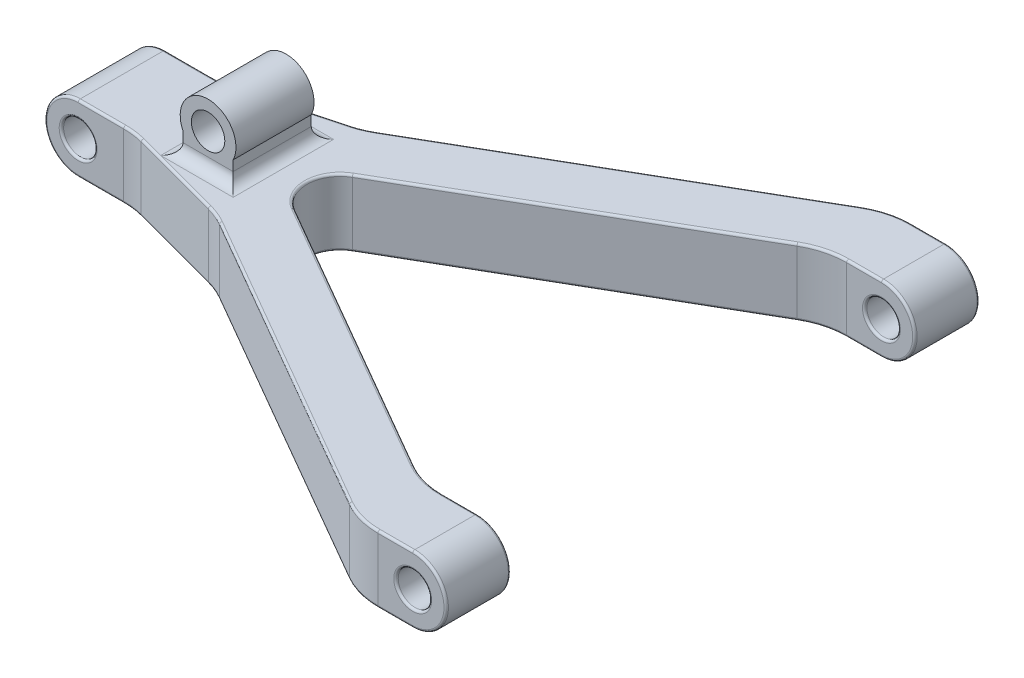
from build123d import *

# Parameters (mm, degrees)
BOSS_EXTRUDE1_DEPTH     = 60
SKETCH2_R               = 30
BOSS_EXTRUDE2_DEPTH     = 78
SKETCH3_R               = 15
CUT_EXTRUDE1_DEPTH      = 78
SKETCH4_R               = 30
BOSS_EXTRUDE3_DEPTH     = 57.74
BOSS_EXTRUDE4_START     = -57.74
SKETCH5_R               = 30
BOSS_EXTRUDE4_DEPTH     = 57.74
CUT_EXTRUDE2_DEPTH      = 588.619530081
CUT_EXTRUDE2_DEPTH_BACK = 588.619530081
SKETCH7_R               = 15
FILLET1_R               = 70
FILLET2_R               = 2
SKETCH8_W               = 45
SKETCH8_H               = 70
BOSS_EXTRUDE5_DEPTH     = 30
SKETCH11_R              = 25
BOSS_EXTRUDE6_DEPTH     = 70
SKETCH12_R              = 15
CUT_EXTRUDE3_DEPTH      = 449.902787027
FILLET3_R               = 10


with BuildPart() as part:
    # Sketch1 → Boss-Extrude1 (new body)
    with BuildSketch(Plane(origin=(0, 0, 0), x_dir=(1, 0, 0), z_dir=(0, 1, 0))):
        with BuildLine():
            Line((-193.529032258, -39), (-193.529032258, 39))
            Line((-193.529032258, 39), (-143.529032258, 39))
            Line((-143.529032258, 39), (-43.529032258, 65.794919243))
            Line((-43.529032258, 65.794919243), (256.470967742, 239))
            Line((256.470967742, 239), (306.470967742, 239))
            Line((306.470967742, 239), (306.470967742, 181.26))
            Line((306.470967742, 181.26), (256.462354113, 181.26))
            Line((256.462354113, 181.26), (-12.489175267, 25.980762114))
            ThreePointArc((-12.489175267, 25.980762114), (-27.489175267, 0), (-12.489175267, -25.980762114))
            Line((-12.489175267, -25.980762114), (256.462354113, -181.26))
            Line((256.462354113, -181.26), (306.470967742, -181.26))
            Line((306.470967742, -181.26), (306.470967742, -239))
            Line((306.470967742, -239), (256.470967742, -239))
            Line((256.470967742, -239), (-43.529032258, -65.794919243))
            Line((-43.529032258, -65.794919243), (-143.529032258, -39))
            Line((-143.529032258, -39), (-193.529032258, -39))
        make_face()
    extrude(amount=BOSS_EXTRUDE1_DEPTH)

    # Sketch2 → Boss-Extrude2 (add)
    with BuildSketch(Plane.XY.offset(39)):
        with Locations((-193.529032258, 30)):
            Circle(SKETCH2_R)
    extrude(amount=-BOSS_EXTRUDE2_DEPTH)

    # Sketch3 → Cut-Extrude1 (cut)
    with BuildSketch(Plane.XY.offset(39)):
        with Locations((-193.529032258, 30)):
            Circle(SKETCH3_R)
    extrude(amount=-CUT_EXTRUDE1_DEPTH, mode=Mode.SUBTRACT)

    # Sketch4 → Boss-Extrude3 (add)
    with BuildSketch(Plane(origin=(0, 0, -239), x_dir=(-1, 0, 0), z_dir=(0, 0, -1))):
        with Locations((-306.470967742, 30)):
            Circle(SKETCH4_R)
    extrude(amount=-BOSS_EXTRUDE3_DEPTH)

    # Sketch5 → Boss-Extrude4 (add)
    with BuildSketch(Plane.XY.offset(239).offset(BOSS_EXTRUDE4_START)):
        with Locations((306.470967742, 30)):
            Circle(SKETCH5_R)
    extrude(amount=BOSS_EXTRUDE4_DEPTH)

    # Sketch7 → Cut-Extrude2 (cut, two sides: drawn at the far end of the back side and taken through both)
    with BuildSketch(Plane(origin=(0, 0, -239), x_dir=(-1, 0, 0), z_dir=(0, 0, -1)).offset(-CUT_EXTRUDE2_DEPTH_BACK)):
        with Locations((-306.470967742, 30)):
            Circle(SKETCH7_R)
    extrude(amount=CUT_EXTRUDE2_DEPTH + CUT_EXTRUDE2_DEPTH_BACK, mode=Mode.SUBTRACT)

    # Fillet1
    fillet1_edges = [part.edges().sort_by_distance(p)[0] for p in [
        (256.462354113, 30, -181.26),
        (256.462354113, 30, 181.26),
        (256.470967742, 30, 239),
        (-43.529032258, 30, 65.794919243),
        (-143.529032258, 30, 39),
        (-143.529032258, 30, -39),
        (-43.529032258, 30, -65.794919243),
        (256.470967742, 30, -239),
    ]]
    fillet(fillet1_edges, radius=FILLET1_R)

    # Fillet2
    fillet2_edges = [part.edges().sort_by_distance(p)[0] for p in [
        (290.844882663, 60, -181.26),
        (102.339693735, 60, -150.012267462),
        (113.864811158, 60, 98.931270189),
        (257.110078055, 60, -236.61480784),
        (257.110078055, 60, 236.61480784),
        (-143.607873634, 0, -39.598859704),
        (-143.607873634, 60, -39.598859704),
        (-143.607873634, 0, 39.598859704),
        (-143.607873634, 60, 39.598859704),
        (-43.760183476, 0, 66.352967648),
        (-43.760183476, 60, 66.352967648),
        (257.101464426, 0, 178.87480784),
        (257.101464426, 60, 178.87480784),
        (257.101464426, 0, -178.87480784),
        (257.101464426, 60, -178.87480784),
        (-43.760183476, 0, -66.352967648),
        (-43.760183476, 60, -66.352967648),
        (290.849189477, 60, -239),
        (113.864811158, 0, -98.931270189),
        (-27.489175267, 0, 0),
        (290.844882663, 0, 181.26),
        (-173.136869674, 0, 39),
        (290.849189477, 0, -239),
        (-173.136869674, 60, 39),
        (-223.529032258, 30, 39),
        (-223.529032258, 30, -39),
        (290.844882663, 60, 181.26),
        (-208.529032258, 30, 39),
        (-208.529032258, 30, -39),
        (336.470967742, 30, -239),
        (-27.489175267, 60, 0),
        (336.470967742, 30, -181.26),
        (113.864811158, 60, -98.931270189),
        (336.470967742, 30, 239),
        (336.470967742, 30, 181.26),
        (321.470967742, 30, -239),
        (321.470967742, 30, -181.26),
        (321.470967742, 30, 239),
        (321.470967742, 30, 181.26),
        (-173.136869674, 0, -39),
        (-173.136869674, 60, -39),
        (-93.529032258, 0, -52.397459622),
        (-93.529032258, 60, -52.397459622),
        (-93.529032258, 0, 52.397459622),
        (-93.529032258, 60, 52.397459622),
        (290.849189477, 0, 239),
        (290.849189477, 60, 239),
        (290.844882663, 0, -181.26),
        (113.864811158, 0, 98.931270189),
        (102.339693735, 0, 150.012267462),
        (102.339693735, 0, -150.012267462),
        (257.110078055, 0, -236.61480784),
        (257.110078055, 0, 236.61480784),
        (102.339693735, 60, 150.012267462),
    ]]
    fillet(fillet2_edges, radius=FILLET2_R)

    # Sketch8 → Boss-Extrude5 (add)
    with BuildSketch(Plane(origin=(0, 60, 0), x_dir=(1, 0, 0), z_dir=(0, 1, 0))):
        with Locations((-81.029032258, 0)):
            Rectangle(SKETCH8_W, SKETCH8_H)
    extrude(amount=BOSS_EXTRUDE5_DEPTH)

    # Sketch11 → Boss-Extrude6 (add)
    with BuildSketch(Plane.XY.offset(35)):
        with Locations((-81.029032258, 90)):
            Circle(SKETCH11_R)
    extrude(amount=-BOSS_EXTRUDE6_DEPTH)

    # Sketch12 → Cut-Extrude3 (cut, through all)
    with BuildSketch(Plane.XY.offset(35)):
        with Locations((-81.029032258, 90)):
            Circle(SKETCH12_R)
    extrude(amount=-CUT_EXTRUDE3_DEPTH, mode=Mode.SUBTRACT)

    # Fillet3
    # the kernel refuses this fillet: 10 mm, written as the material it adds along each edge
    with BuildSketch(Plane(origin=(-58.529032258, 60, -35), x_dir=(1, 0, 0), z_dir=(0, 0, 1)), Plane(origin=(-103.529032258, 60, 35), x_dir=(-1, 0, 0), z_dir=(0, 0, -1))) as fillet3_piece_1:
        with BuildLine():
            CenterArc((FILLET3_R, FILLET3_R), FILLET3_R, 180, 90)
            Line((0, FILLET3_R), (0, 0))
            Line((0, 0), (FILLET3_R, 0))
        make_face()
    extrude(amount=70)
    with BuildSketch(Plane(origin=(-103.529032258, 60, -35), x_dir=(0, 0, -1), z_dir=(1, 0, 0)), Plane(origin=(-58.529032258, 60, 35), x_dir=(0, 0, 1), z_dir=(-1, 0, 0))) as fillet3_piece_2:
        with BuildLine():
            CenterArc((FILLET3_R, FILLET3_R), FILLET3_R, 180, 90)
            Line((0, FILLET3_R), (0, 0))
            Line((0, 0), (FILLET3_R, 0))
        make_face()
    extrude(amount=45)
    with BuildSketch(Plane(origin=(-103.529032258, 60, -35), x_dir=(0, 0, -1), z_dir=(1, 0, 0))) as fillet3_piece_3a_section:
        with BuildLine():
            CenterArc((FILLET3_R, FILLET3_R), FILLET3_R, 180, 90)
            Line((0, FILLET3_R), (0, 0))
            Line((0, 0), (FILLET3_R, 0))
        make_face()
    fillet3_piece_3a = extrude(amount=70, mode=Mode.PRIVATE)
    fillet3_piece_3a = split(fillet3_piece_3a, bisect_by=Plane(origin=(-58.529032258, 62.263951143, -37.263951143), z_dir=(1, 0, 0)), keep=Keep.TOP, mode=Mode.PRIVATE)
    with BuildSketch(Plane(origin=(-58.529032258, 60, -60), x_dir=(1, 0, 0), z_dir=(0, 0, 1))) as fillet3_piece_3b_section:
        with BuildLine():
            CenterArc((FILLET3_R, FILLET3_R), FILLET3_R, 180, 90)
            Line((0, FILLET3_R), (0, 0))
            Line((0, 0), (FILLET3_R, 0))
        make_face()
    fillet3_piece_3b = extrude(amount=95, mode=Mode.PRIVATE)
    fillet3_piece_3b = split(fillet3_piece_3b, bisect_by=Plane(origin=(-56.265081115, 62.263951143, -35), z_dir=(0, 0, -1)), keep=Keep.TOP, mode=Mode.PRIVATE)
    fillet3_piece_3 = fillet3_piece_3a & fillet3_piece_3b
    add(fillet3_piece_3)
    with BuildSketch(Plane(origin=(-58.529032258, 60, -35), x_dir=(1, 0, 0), z_dir=(0, 0, 1))) as fillet3_piece_4a_section:
        with BuildLine():
            CenterArc((FILLET3_R, FILLET3_R), FILLET3_R, 180, 90)
            Line((0, FILLET3_R), (0, 0))
            Line((0, 0), (FILLET3_R, 0))
        make_face()
    fillet3_piece_4a = extrude(amount=95, mode=Mode.PRIVATE)
    fillet3_piece_4a = split(fillet3_piece_4a, bisect_by=Plane(origin=(-56.265081115, 62.263951143, 35), z_dir=(0, 0, 1)), keep=Keep.TOP, mode=Mode.PRIVATE)
    with BuildSketch(Plane(origin=(-33.529032258, 60, 35), x_dir=(0, 0, 1), z_dir=(-1, 0, 0))) as fillet3_piece_4b_section:
        with BuildLine():
            CenterArc((FILLET3_R, FILLET3_R), FILLET3_R, 180, 90)
            Line((0, FILLET3_R), (0, 0))
            Line((0, 0), (FILLET3_R, 0))
        make_face()
    fillet3_piece_4b = extrude(amount=70, mode=Mode.PRIVATE)
    fillet3_piece_4b = split(fillet3_piece_4b, bisect_by=Plane(origin=(-58.529032258, 62.263951143, 37.263951143), z_dir=(1, 0, 0)), keep=Keep.TOP, mode=Mode.PRIVATE)
    fillet3_piece_4 = fillet3_piece_4a & fillet3_piece_4b
    add(fillet3_piece_4)
    with BuildSketch(Plane(origin=(-128.529032258, 60, -35), x_dir=(0, 0, -1), z_dir=(1, 0, 0))) as fillet3_piece_5a_section:
        with BuildLine():
            CenterArc((FILLET3_R, FILLET3_R), FILLET3_R, 180, 90)
            Line((0, FILLET3_R), (0, 0))
            Line((0, 0), (FILLET3_R, 0))
        make_face()
    fillet3_piece_5a = extrude(amount=70, mode=Mode.PRIVATE)
    fillet3_piece_5a = split(fillet3_piece_5a, bisect_by=Plane(origin=(-103.529032258, 62.263951143, -37.263951143), z_dir=(-1, 0, 0)), keep=Keep.TOP, mode=Mode.PRIVATE)
    with BuildSketch(Plane(origin=(-103.529032258, 60, 35), x_dir=(-1, 0, 0), z_dir=(0, 0, -1))) as fillet3_piece_5b_section:
        with BuildLine():
            CenterArc((FILLET3_R, FILLET3_R), FILLET3_R, 180, 90)
            Line((0, FILLET3_R), (0, 0))
            Line((0, 0), (FILLET3_R, 0))
        make_face()
    fillet3_piece_5b = extrude(amount=95, mode=Mode.PRIVATE)
    fillet3_piece_5b = split(fillet3_piece_5b, bisect_by=Plane(origin=(-105.792983401, 62.263951143, -35), z_dir=(0, 0, -1)), keep=Keep.TOP, mode=Mode.PRIVATE)
    fillet3_piece_5 = fillet3_piece_5a & fillet3_piece_5b
    add(fillet3_piece_5)
    with BuildSketch(Plane(origin=(-58.529032258, 60, 35), x_dir=(0, 0, 1), z_dir=(-1, 0, 0))) as fillet3_piece_6a_section:
        with BuildLine():
            CenterArc((FILLET3_R, FILLET3_R), FILLET3_R, 180, 90)
            Line((0, FILLET3_R), (0, 0))
            Line((0, 0), (FILLET3_R, 0))
        make_face()
    fillet3_piece_6a = extrude(amount=70, mode=Mode.PRIVATE)
    fillet3_piece_6a = split(fillet3_piece_6a, bisect_by=Plane(origin=(-103.529032258, 62.263951143, 37.263951143), z_dir=(-1, 0, 0)), keep=Keep.TOP, mode=Mode.PRIVATE)
    with BuildSketch(Plane(origin=(-103.529032258, 60, 60), x_dir=(-1, 0, 0), z_dir=(0, 0, -1))) as fillet3_piece_6b_section:
        with BuildLine():
            CenterArc((FILLET3_R, FILLET3_R), FILLET3_R, 180, 90)
            Line((0, FILLET3_R), (0, 0))
            Line((0, 0), (FILLET3_R, 0))
        make_face()
    fillet3_piece_6b = extrude(amount=95, mode=Mode.PRIVATE)
    fillet3_piece_6b = split(fillet3_piece_6b, bisect_by=Plane(origin=(-105.792983401, 62.263951143, 35), z_dir=(0, 0, 1)), keep=Keep.TOP, mode=Mode.PRIVATE)
    fillet3_piece_6 = fillet3_piece_6a & fillet3_piece_6b
    add(fillet3_piece_6)


solid = part.part
